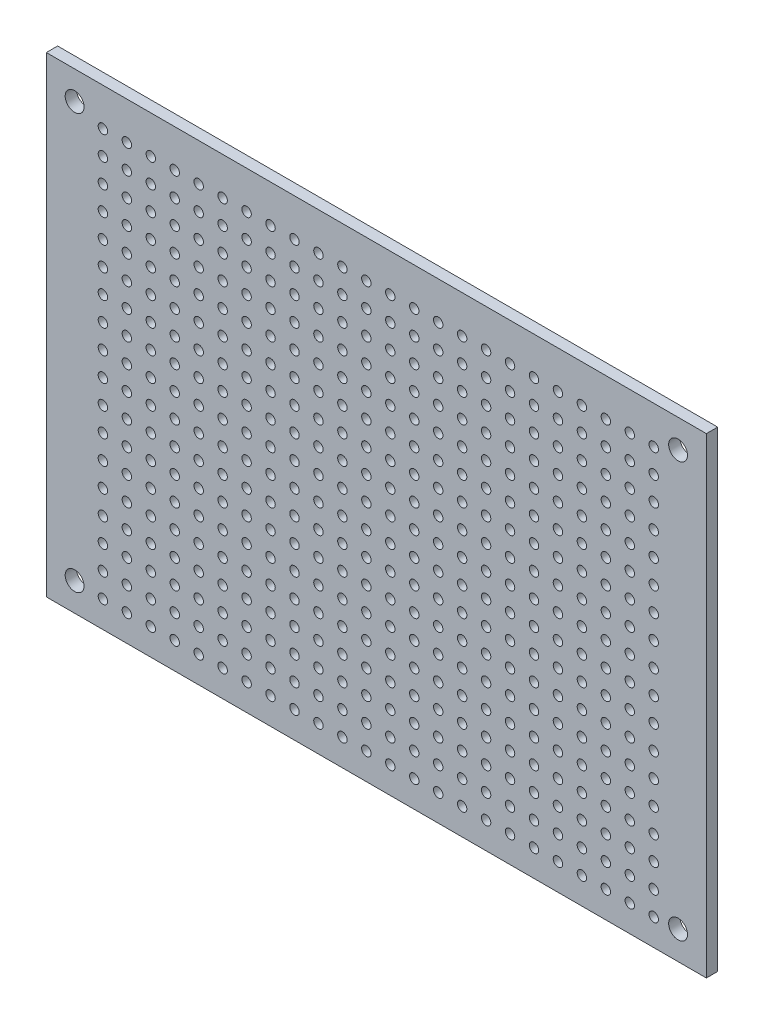
from build123d import *

# Parameters (mm, degrees)
SKETCH_1_W      = 70
SKETCH_1_H      = 50
SKETCH_1_R      = 0.5
SKETCH_1_R_2    = 1
EXTRUDE_1_DEPTH = 1.2


with BuildPart() as part:
    # Эскиз1 → Бобышка-Вытянуть1 (new body)
    with BuildSketch(Plane.XY):
        with Locations((35, 25)):
            Rectangle(SKETCH_1_W, SKETCH_1_H)
        with Locations((6, 46)):
            Circle(SKETCH_1_R, mode=Mode.SUBTRACT)
        with Locations((3, 47)):
            Circle(SKETCH_1_R_2, mode=Mode.SUBTRACT)
        with Locations((67, 47)):
            Circle(SKETCH_1_R_2, mode=Mode.SUBTRACT)
        with Locations((67, 3)):
            Circle(SKETCH_1_R_2, mode=Mode.SUBTRACT)
        with Locations((3, 3)):
            Circle(SKETCH_1_R_2, mode=Mode.SUBTRACT)
        with Locations((8.54, 46)):
            Circle(SKETCH_1_R, mode=Mode.SUBTRACT)
        with Locations((11.08, 46)):
            Circle(SKETCH_1_R, mode=Mode.SUBTRACT)
        with Locations((13.62, 46)):
            Circle(SKETCH_1_R, mode=Mode.SUBTRACT)
        with Locations((16.16, 46)):
            Circle(SKETCH_1_R, mode=Mode.SUBTRACT)
        with Locations((18.7, 46)):
            Circle(SKETCH_1_R, mode=Mode.SUBTRACT)
        with Locations((21.24, 46)):
            Circle(SKETCH_1_R, mode=Mode.SUBTRACT)
        with Locations((23.78, 46)):
            Circle(SKETCH_1_R, mode=Mode.SUBTRACT)
        with Locations((26.32, 46)):
            Circle(SKETCH_1_R, mode=Mode.SUBTRACT)
        with Locations((28.86, 46)):
            Circle(SKETCH_1_R, mode=Mode.SUBTRACT)
        with Locations((31.4, 46)):
            Circle(SKETCH_1_R, mode=Mode.SUBTRACT)
        with Locations((33.94, 46)):
            Circle(SKETCH_1_R, mode=Mode.SUBTRACT)
        with Locations((36.48, 46)):
            Circle(SKETCH_1_R, mode=Mode.SUBTRACT)
        with Locations((39.02, 46)):
            Circle(SKETCH_1_R, mode=Mode.SUBTRACT)
        with Locations((41.56, 46)):
            Circle(SKETCH_1_R, mode=Mode.SUBTRACT)
        with Locations((44.1, 46)):
            Circle(SKETCH_1_R, mode=Mode.SUBTRACT)
        with Locations((46.64, 46)):
            Circle(SKETCH_1_R, mode=Mode.SUBTRACT)
        with Locations((49.18, 46)):
            Circle(SKETCH_1_R, mode=Mode.SUBTRACT)
        with Locations((51.72, 46)):
            Circle(SKETCH_1_R, mode=Mode.SUBTRACT)
        with Locations((54.26, 46)):
            Circle(SKETCH_1_R, mode=Mode.SUBTRACT)
        with Locations((56.8, 46)):
            Circle(SKETCH_1_R, mode=Mode.SUBTRACT)
        with Locations((59.34, 46)):
            Circle(SKETCH_1_R, mode=Mode.SUBTRACT)
        with Locations((61.88, 46)):
            Circle(SKETCH_1_R, mode=Mode.SUBTRACT)
        with Locations((64.42, 46)):
            Circle(SKETCH_1_R, mode=Mode.SUBTRACT)
        with Locations((8.54, 43.46)):
            Circle(SKETCH_1_R, mode=Mode.SUBTRACT)
        with Locations((11.08, 43.46)):
            Circle(SKETCH_1_R, mode=Mode.SUBTRACT)
        with Locations((13.62, 43.46)):
            Circle(SKETCH_1_R, mode=Mode.SUBTRACT)
        with Locations((16.16, 43.46)):
            Circle(SKETCH_1_R, mode=Mode.SUBTRACT)
        with Locations((18.7, 43.46)):
            Circle(SKETCH_1_R, mode=Mode.SUBTRACT)
        with Locations((21.24, 43.46)):
            Circle(SKETCH_1_R, mode=Mode.SUBTRACT)
        with Locations((23.78, 43.46)):
            Circle(SKETCH_1_R, mode=Mode.SUBTRACT)
        with Locations((26.32, 43.46)):
            Circle(SKETCH_1_R, mode=Mode.SUBTRACT)
        with Locations((28.86, 43.46)):
            Circle(SKETCH_1_R, mode=Mode.SUBTRACT)
        with Locations((31.4, 43.46)):
            Circle(SKETCH_1_R, mode=Mode.SUBTRACT)
        with Locations((33.94, 43.46)):
            Circle(SKETCH_1_R, mode=Mode.SUBTRACT)
        with Locations((36.48, 43.46)):
            Circle(SKETCH_1_R, mode=Mode.SUBTRACT)
        with Locations((39.02, 43.46)):
            Circle(SKETCH_1_R, mode=Mode.SUBTRACT)
        with Locations((41.56, 43.46)):
            Circle(SKETCH_1_R, mode=Mode.SUBTRACT)
        with Locations((44.1, 43.46)):
            Circle(SKETCH_1_R, mode=Mode.SUBTRACT)
        with Locations((46.64, 43.46)):
            Circle(SKETCH_1_R, mode=Mode.SUBTRACT)
        with Locations((49.18, 43.46)):
            Circle(SKETCH_1_R, mode=Mode.SUBTRACT)
        with Locations((51.72, 43.46)):
            Circle(SKETCH_1_R, mode=Mode.SUBTRACT)
        with Locations((54.26, 43.46)):
            Circle(SKETCH_1_R, mode=Mode.SUBTRACT)
        with Locations((56.8, 43.46)):
            Circle(SKETCH_1_R, mode=Mode.SUBTRACT)
        with Locations((59.34, 43.46)):
            Circle(SKETCH_1_R, mode=Mode.SUBTRACT)
        with Locations((61.88, 43.46)):
            Circle(SKETCH_1_R, mode=Mode.SUBTRACT)
        with Locations((64.42, 43.46)):
            Circle(SKETCH_1_R, mode=Mode.SUBTRACT)
        with Locations((8.54, 40.92)):
            Circle(SKETCH_1_R, mode=Mode.SUBTRACT)
        with Locations((11.08, 40.92)):
            Circle(SKETCH_1_R, mode=Mode.SUBTRACT)
        with Locations((13.62, 40.92)):
            Circle(SKETCH_1_R, mode=Mode.SUBTRACT)
        with Locations((16.16, 40.92)):
            Circle(SKETCH_1_R, mode=Mode.SUBTRACT)
        with Locations((18.7, 40.92)):
            Circle(SKETCH_1_R, mode=Mode.SUBTRACT)
        with Locations((21.24, 40.92)):
            Circle(SKETCH_1_R, mode=Mode.SUBTRACT)
        with Locations((23.78, 40.92)):
            Circle(SKETCH_1_R, mode=Mode.SUBTRACT)
        with Locations((26.32, 40.92)):
            Circle(SKETCH_1_R, mode=Mode.SUBTRACT)
        with Locations((28.86, 40.92)):
            Circle(SKETCH_1_R, mode=Mode.SUBTRACT)
        with Locations((31.4, 40.92)):
            Circle(SKETCH_1_R, mode=Mode.SUBTRACT)
        with Locations((33.94, 40.92)):
            Circle(SKETCH_1_R, mode=Mode.SUBTRACT)
        with Locations((36.48, 40.92)):
            Circle(SKETCH_1_R, mode=Mode.SUBTRACT)
        with Locations((39.02, 40.92)):
            Circle(SKETCH_1_R, mode=Mode.SUBTRACT)
        with Locations((41.56, 40.92)):
            Circle(SKETCH_1_R, mode=Mode.SUBTRACT)
        with Locations((44.1, 40.92)):
            Circle(SKETCH_1_R, mode=Mode.SUBTRACT)
        with Locations((46.64, 40.92)):
            Circle(SKETCH_1_R, mode=Mode.SUBTRACT)
        with Locations((49.18, 40.92)):
            Circle(SKETCH_1_R, mode=Mode.SUBTRACT)
        with Locations((51.72, 40.92)):
            Circle(SKETCH_1_R, mode=Mode.SUBTRACT)
        with Locations((54.26, 40.92)):
            Circle(SKETCH_1_R, mode=Mode.SUBTRACT)
        with Locations((56.8, 40.92)):
            Circle(SKETCH_1_R, mode=Mode.SUBTRACT)
        with Locations((59.34, 40.92)):
            Circle(SKETCH_1_R, mode=Mode.SUBTRACT)
        with Locations((61.88, 40.92)):
            Circle(SKETCH_1_R, mode=Mode.SUBTRACT)
        with Locations((64.42, 40.92)):
            Circle(SKETCH_1_R, mode=Mode.SUBTRACT)
        with Locations((8.54, 38.38)):
            Circle(SKETCH_1_R, mode=Mode.SUBTRACT)
        with Locations((11.08, 38.38)):
            Circle(SKETCH_1_R, mode=Mode.SUBTRACT)
        with Locations((13.62, 38.38)):
            Circle(SKETCH_1_R, mode=Mode.SUBTRACT)
        with Locations((16.16, 38.38)):
            Circle(SKETCH_1_R, mode=Mode.SUBTRACT)
        with Locations((18.7, 38.38)):
            Circle(SKETCH_1_R, mode=Mode.SUBTRACT)
        with Locations((21.24, 38.38)):
            Circle(SKETCH_1_R, mode=Mode.SUBTRACT)
        with Locations((23.78, 38.38)):
            Circle(SKETCH_1_R, mode=Mode.SUBTRACT)
        with Locations((26.32, 38.38)):
            Circle(SKETCH_1_R, mode=Mode.SUBTRACT)
        with Locations((28.86, 38.38)):
            Circle(SKETCH_1_R, mode=Mode.SUBTRACT)
        with Locations((31.4, 38.38)):
            Circle(SKETCH_1_R, mode=Mode.SUBTRACT)
        with Locations((33.94, 38.38)):
            Circle(SKETCH_1_R, mode=Mode.SUBTRACT)
        with Locations((36.48, 38.38)):
            Circle(SKETCH_1_R, mode=Mode.SUBTRACT)
        with Locations((39.02, 38.38)):
            Circle(SKETCH_1_R, mode=Mode.SUBTRACT)
        with Locations((41.56, 38.38)):
            Circle(SKETCH_1_R, mode=Mode.SUBTRACT)
        with Locations((44.1, 38.38)):
            Circle(SKETCH_1_R, mode=Mode.SUBTRACT)
        with Locations((46.64, 38.38)):
            Circle(SKETCH_1_R, mode=Mode.SUBTRACT)
        with Locations((49.18, 38.38)):
            Circle(SKETCH_1_R, mode=Mode.SUBTRACT)
        with Locations((51.72, 38.38)):
            Circle(SKETCH_1_R, mode=Mode.SUBTRACT)
        with Locations((54.26, 38.38)):
            Circle(SKETCH_1_R, mode=Mode.SUBTRACT)
        with Locations((56.8, 38.38)):
            Circle(SKETCH_1_R, mode=Mode.SUBTRACT)
        with Locations((59.34, 38.38)):
            Circle(SKETCH_1_R, mode=Mode.SUBTRACT)
        with Locations((61.88, 38.38)):
            Circle(SKETCH_1_R, mode=Mode.SUBTRACT)
        with Locations((64.42, 38.38)):
            Circle(SKETCH_1_R, mode=Mode.SUBTRACT)
        with Locations((8.54, 35.84)):
            Circle(SKETCH_1_R, mode=Mode.SUBTRACT)
        with Locations((11.08, 35.84)):
            Circle(SKETCH_1_R, mode=Mode.SUBTRACT)
        with Locations((13.62, 35.84)):
            Circle(SKETCH_1_R, mode=Mode.SUBTRACT)
        with Locations((16.16, 35.84)):
            Circle(SKETCH_1_R, mode=Mode.SUBTRACT)
        with Locations((18.7, 35.84)):
            Circle(SKETCH_1_R, mode=Mode.SUBTRACT)
        with Locations((21.24, 35.84)):
            Circle(SKETCH_1_R, mode=Mode.SUBTRACT)
        with Locations((23.78, 35.84)):
            Circle(SKETCH_1_R, mode=Mode.SUBTRACT)
        with Locations((26.32, 35.84)):
            Circle(SKETCH_1_R, mode=Mode.SUBTRACT)
        with Locations((28.86, 35.84)):
            Circle(SKETCH_1_R, mode=Mode.SUBTRACT)
        with Locations((31.4, 35.84)):
            Circle(SKETCH_1_R, mode=Mode.SUBTRACT)
        with Locations((33.94, 35.84)):
            Circle(SKETCH_1_R, mode=Mode.SUBTRACT)
        with Locations((36.48, 35.84)):
            Circle(SKETCH_1_R, mode=Mode.SUBTRACT)
        with Locations((39.02, 35.84)):
            Circle(SKETCH_1_R, mode=Mode.SUBTRACT)
        with Locations((41.56, 35.84)):
            Circle(SKETCH_1_R, mode=Mode.SUBTRACT)
        with Locations((44.1, 35.84)):
            Circle(SKETCH_1_R, mode=Mode.SUBTRACT)
        with Locations((46.64, 35.84)):
            Circle(SKETCH_1_R, mode=Mode.SUBTRACT)
        with Locations((49.18, 35.84)):
            Circle(SKETCH_1_R, mode=Mode.SUBTRACT)
        with Locations((51.72, 35.84)):
            Circle(SKETCH_1_R, mode=Mode.SUBTRACT)
        with Locations((54.26, 35.84)):
            Circle(SKETCH_1_R, mode=Mode.SUBTRACT)
        with Locations((56.8, 35.84)):
            Circle(SKETCH_1_R, mode=Mode.SUBTRACT)
        with Locations((59.34, 35.84)):
            Circle(SKETCH_1_R, mode=Mode.SUBTRACT)
        with Locations((61.88, 35.84)):
            Circle(SKETCH_1_R, mode=Mode.SUBTRACT)
        with Locations((64.42, 35.84)):
            Circle(SKETCH_1_R, mode=Mode.SUBTRACT)
        with Locations((8.54, 33.3)):
            Circle(SKETCH_1_R, mode=Mode.SUBTRACT)
        with Locations((11.08, 33.3)):
            Circle(SKETCH_1_R, mode=Mode.SUBTRACT)
        with Locations((13.62, 33.3)):
            Circle(SKETCH_1_R, mode=Mode.SUBTRACT)
        with Locations((16.16, 33.3)):
            Circle(SKETCH_1_R, mode=Mode.SUBTRACT)
        with Locations((18.7, 33.3)):
            Circle(SKETCH_1_R, mode=Mode.SUBTRACT)
        with Locations((21.24, 33.3)):
            Circle(SKETCH_1_R, mode=Mode.SUBTRACT)
        with Locations((23.78, 33.3)):
            Circle(SKETCH_1_R, mode=Mode.SUBTRACT)
        with Locations((26.32, 33.3)):
            Circle(SKETCH_1_R, mode=Mode.SUBTRACT)
        with Locations((28.86, 33.3)):
            Circle(SKETCH_1_R, mode=Mode.SUBTRACT)
        with Locations((31.4, 33.3)):
            Circle(SKETCH_1_R, mode=Mode.SUBTRACT)
        with Locations((33.94, 33.3)):
            Circle(SKETCH_1_R, mode=Mode.SUBTRACT)
        with Locations((36.48, 33.3)):
            Circle(SKETCH_1_R, mode=Mode.SUBTRACT)
        with Locations((39.02, 33.3)):
            Circle(SKETCH_1_R, mode=Mode.SUBTRACT)
        with Locations((41.56, 33.3)):
            Circle(SKETCH_1_R, mode=Mode.SUBTRACT)
        with Locations((44.1, 33.3)):
            Circle(SKETCH_1_R, mode=Mode.SUBTRACT)
        with Locations((46.64, 33.3)):
            Circle(SKETCH_1_R, mode=Mode.SUBTRACT)
        with Locations((49.18, 33.3)):
            Circle(SKETCH_1_R, mode=Mode.SUBTRACT)
        with Locations((51.72, 33.3)):
            Circle(SKETCH_1_R, mode=Mode.SUBTRACT)
        with Locations((54.26, 33.3)):
            Circle(SKETCH_1_R, mode=Mode.SUBTRACT)
        with Locations((56.8, 33.3)):
            Circle(SKETCH_1_R, mode=Mode.SUBTRACT)
        with Locations((59.34, 33.3)):
            Circle(SKETCH_1_R, mode=Mode.SUBTRACT)
        with Locations((61.88, 33.3)):
            Circle(SKETCH_1_R, mode=Mode.SUBTRACT)
        with Locations((64.42, 33.3)):
            Circle(SKETCH_1_R, mode=Mode.SUBTRACT)
        with Locations((8.54, 30.76)):
            Circle(SKETCH_1_R, mode=Mode.SUBTRACT)
        with Locations((11.08, 30.76)):
            Circle(SKETCH_1_R, mode=Mode.SUBTRACT)
        with Locations((13.62, 30.76)):
            Circle(SKETCH_1_R, mode=Mode.SUBTRACT)
        with Locations((16.16, 30.76)):
            Circle(SKETCH_1_R, mode=Mode.SUBTRACT)
        with Locations((18.7, 30.76)):
            Circle(SKETCH_1_R, mode=Mode.SUBTRACT)
        with Locations((21.24, 30.76)):
            Circle(SKETCH_1_R, mode=Mode.SUBTRACT)
        with Locations((23.78, 30.76)):
            Circle(SKETCH_1_R, mode=Mode.SUBTRACT)
        with Locations((26.32, 30.76)):
            Circle(SKETCH_1_R, mode=Mode.SUBTRACT)
        with Locations((28.86, 30.76)):
            Circle(SKETCH_1_R, mode=Mode.SUBTRACT)
        with Locations((31.4, 30.76)):
            Circle(SKETCH_1_R, mode=Mode.SUBTRACT)
        with Locations((33.94, 30.76)):
            Circle(SKETCH_1_R, mode=Mode.SUBTRACT)
        with Locations((36.48, 30.76)):
            Circle(SKETCH_1_R, mode=Mode.SUBTRACT)
        with Locations((39.02, 30.76)):
            Circle(SKETCH_1_R, mode=Mode.SUBTRACT)
        with Locations((41.56, 30.76)):
            Circle(SKETCH_1_R, mode=Mode.SUBTRACT)
        with Locations((44.1, 30.76)):
            Circle(SKETCH_1_R, mode=Mode.SUBTRACT)
        with Locations((46.64, 30.76)):
            Circle(SKETCH_1_R, mode=Mode.SUBTRACT)
        with Locations((49.18, 30.76)):
            Circle(SKETCH_1_R, mode=Mode.SUBTRACT)
        with Locations((51.72, 30.76)):
            Circle(SKETCH_1_R, mode=Mode.SUBTRACT)
        with Locations((54.26, 30.76)):
            Circle(SKETCH_1_R, mode=Mode.SUBTRACT)
        with Locations((56.8, 30.76)):
            Circle(SKETCH_1_R, mode=Mode.SUBTRACT)
        with Locations((59.34, 30.76)):
            Circle(SKETCH_1_R, mode=Mode.SUBTRACT)
        with Locations((61.88, 30.76)):
            Circle(SKETCH_1_R, mode=Mode.SUBTRACT)
        with Locations((64.42, 30.76)):
            Circle(SKETCH_1_R, mode=Mode.SUBTRACT)
        with Locations((8.54, 28.22)):
            Circle(SKETCH_1_R, mode=Mode.SUBTRACT)
        with Locations((11.08, 28.22)):
            Circle(SKETCH_1_R, mode=Mode.SUBTRACT)
        with Locations((13.62, 28.22)):
            Circle(SKETCH_1_R, mode=Mode.SUBTRACT)
        with Locations((16.16, 28.22)):
            Circle(SKETCH_1_R, mode=Mode.SUBTRACT)
        with Locations((18.7, 28.22)):
            Circle(SKETCH_1_R, mode=Mode.SUBTRACT)
        with Locations((21.24, 28.22)):
            Circle(SKETCH_1_R, mode=Mode.SUBTRACT)
        with Locations((23.78, 28.22)):
            Circle(SKETCH_1_R, mode=Mode.SUBTRACT)
        with Locations((26.32, 28.22)):
            Circle(SKETCH_1_R, mode=Mode.SUBTRACT)
        with Locations((28.86, 28.22)):
            Circle(SKETCH_1_R, mode=Mode.SUBTRACT)
        with Locations((31.4, 28.22)):
            Circle(SKETCH_1_R, mode=Mode.SUBTRACT)
        with Locations((33.94, 28.22)):
            Circle(SKETCH_1_R, mode=Mode.SUBTRACT)
        with Locations((36.48, 28.22)):
            Circle(SKETCH_1_R, mode=Mode.SUBTRACT)
        with Locations((39.02, 28.22)):
            Circle(SKETCH_1_R, mode=Mode.SUBTRACT)
        with Locations((41.56, 28.22)):
            Circle(SKETCH_1_R, mode=Mode.SUBTRACT)
        with Locations((44.1, 28.22)):
            Circle(SKETCH_1_R, mode=Mode.SUBTRACT)
        with Locations((46.64, 28.22)):
            Circle(SKETCH_1_R, mode=Mode.SUBTRACT)
        with Locations((49.18, 28.22)):
            Circle(SKETCH_1_R, mode=Mode.SUBTRACT)
        with Locations((51.72, 28.22)):
            Circle(SKETCH_1_R, mode=Mode.SUBTRACT)
        with Locations((54.26, 28.22)):
            Circle(SKETCH_1_R, mode=Mode.SUBTRACT)
        with Locations((56.8, 28.22)):
            Circle(SKETCH_1_R, mode=Mode.SUBTRACT)
        with Locations((59.34, 28.22)):
            Circle(SKETCH_1_R, mode=Mode.SUBTRACT)
        with Locations((61.88, 28.22)):
            Circle(SKETCH_1_R, mode=Mode.SUBTRACT)
        with Locations((64.42, 28.22)):
            Circle(SKETCH_1_R, mode=Mode.SUBTRACT)
        with Locations((8.54, 25.68)):
            Circle(SKETCH_1_R, mode=Mode.SUBTRACT)
        with Locations((11.08, 25.68)):
            Circle(SKETCH_1_R, mode=Mode.SUBTRACT)
        with Locations((13.62, 25.68)):
            Circle(SKETCH_1_R, mode=Mode.SUBTRACT)
        with Locations((16.16, 25.68)):
            Circle(SKETCH_1_R, mode=Mode.SUBTRACT)
        with Locations((18.7, 25.68)):
            Circle(SKETCH_1_R, mode=Mode.SUBTRACT)
        with Locations((21.24, 25.68)):
            Circle(SKETCH_1_R, mode=Mode.SUBTRACT)
        with Locations((23.78, 25.68)):
            Circle(SKETCH_1_R, mode=Mode.SUBTRACT)
        with Locations((26.32, 25.68)):
            Circle(SKETCH_1_R, mode=Mode.SUBTRACT)
        with Locations((28.86, 25.68)):
            Circle(SKETCH_1_R, mode=Mode.SUBTRACT)
        with Locations((31.4, 25.68)):
            Circle(SKETCH_1_R, mode=Mode.SUBTRACT)
        with Locations((33.94, 25.68)):
            Circle(SKETCH_1_R, mode=Mode.SUBTRACT)
        with Locations((36.48, 25.68)):
            Circle(SKETCH_1_R, mode=Mode.SUBTRACT)
        with Locations((39.02, 25.68)):
            Circle(SKETCH_1_R, mode=Mode.SUBTRACT)
        with Locations((41.56, 25.68)):
            Circle(SKETCH_1_R, mode=Mode.SUBTRACT)
        with Locations((44.1, 25.68)):
            Circle(SKETCH_1_R, mode=Mode.SUBTRACT)
        with Locations((46.64, 25.68)):
            Circle(SKETCH_1_R, mode=Mode.SUBTRACT)
        with Locations((49.18, 25.68)):
            Circle(SKETCH_1_R, mode=Mode.SUBTRACT)
        with Locations((51.72, 25.68)):
            Circle(SKETCH_1_R, mode=Mode.SUBTRACT)
        with Locations((54.26, 25.68)):
            Circle(SKETCH_1_R, mode=Mode.SUBTRACT)
        with Locations((56.8, 25.68)):
            Circle(SKETCH_1_R, mode=Mode.SUBTRACT)
        with Locations((59.34, 25.68)):
            Circle(SKETCH_1_R, mode=Mode.SUBTRACT)
        with Locations((61.88, 25.68)):
            Circle(SKETCH_1_R, mode=Mode.SUBTRACT)
        with Locations((64.42, 25.68)):
            Circle(SKETCH_1_R, mode=Mode.SUBTRACT)
        with Locations((8.54, 23.14)):
            Circle(SKETCH_1_R, mode=Mode.SUBTRACT)
        with Locations((11.08, 23.14)):
            Circle(SKETCH_1_R, mode=Mode.SUBTRACT)
        with Locations((13.62, 23.14)):
            Circle(SKETCH_1_R, mode=Mode.SUBTRACT)
        with Locations((16.16, 23.14)):
            Circle(SKETCH_1_R, mode=Mode.SUBTRACT)
        with Locations((18.7, 23.14)):
            Circle(SKETCH_1_R, mode=Mode.SUBTRACT)
        with Locations((21.24, 23.14)):
            Circle(SKETCH_1_R, mode=Mode.SUBTRACT)
        with Locations((23.78, 23.14)):
            Circle(SKETCH_1_R, mode=Mode.SUBTRACT)
        with Locations((26.32, 23.14)):
            Circle(SKETCH_1_R, mode=Mode.SUBTRACT)
        with Locations((28.86, 23.14)):
            Circle(SKETCH_1_R, mode=Mode.SUBTRACT)
        with Locations((31.4, 23.14)):
            Circle(SKETCH_1_R, mode=Mode.SUBTRACT)
        with Locations((33.94, 23.14)):
            Circle(SKETCH_1_R, mode=Mode.SUBTRACT)
        with Locations((36.48, 23.14)):
            Circle(SKETCH_1_R, mode=Mode.SUBTRACT)
        with Locations((39.02, 23.14)):
            Circle(SKETCH_1_R, mode=Mode.SUBTRACT)
        with Locations((41.56, 23.14)):
            Circle(SKETCH_1_R, mode=Mode.SUBTRACT)
        with Locations((44.1, 23.14)):
            Circle(SKETCH_1_R, mode=Mode.SUBTRACT)
        with Locations((46.64, 23.14)):
            Circle(SKETCH_1_R, mode=Mode.SUBTRACT)
        with Locations((49.18, 23.14)):
            Circle(SKETCH_1_R, mode=Mode.SUBTRACT)
        with Locations((51.72, 23.14)):
            Circle(SKETCH_1_R, mode=Mode.SUBTRACT)
        with Locations((54.26, 23.14)):
            Circle(SKETCH_1_R, mode=Mode.SUBTRACT)
        with Locations((56.8, 23.14)):
            Circle(SKETCH_1_R, mode=Mode.SUBTRACT)
        with Locations((59.34, 23.14)):
            Circle(SKETCH_1_R, mode=Mode.SUBTRACT)
        with Locations((61.88, 23.14)):
            Circle(SKETCH_1_R, mode=Mode.SUBTRACT)
        with Locations((64.42, 23.14)):
            Circle(SKETCH_1_R, mode=Mode.SUBTRACT)
        with Locations((8.54, 20.6)):
            Circle(SKETCH_1_R, mode=Mode.SUBTRACT)
        with Locations((11.08, 20.6)):
            Circle(SKETCH_1_R, mode=Mode.SUBTRACT)
        with Locations((13.62, 20.6)):
            Circle(SKETCH_1_R, mode=Mode.SUBTRACT)
        with Locations((16.16, 20.6)):
            Circle(SKETCH_1_R, mode=Mode.SUBTRACT)
        with Locations((18.7, 20.6)):
            Circle(SKETCH_1_R, mode=Mode.SUBTRACT)
        with Locations((21.24, 20.6)):
            Circle(SKETCH_1_R, mode=Mode.SUBTRACT)
        with Locations((23.78, 20.6)):
            Circle(SKETCH_1_R, mode=Mode.SUBTRACT)
        with Locations((26.32, 20.6)):
            Circle(SKETCH_1_R, mode=Mode.SUBTRACT)
        with Locations((28.86, 20.6)):
            Circle(SKETCH_1_R, mode=Mode.SUBTRACT)
        with Locations((31.4, 20.6)):
            Circle(SKETCH_1_R, mode=Mode.SUBTRACT)
        with Locations((33.94, 20.6)):
            Circle(SKETCH_1_R, mode=Mode.SUBTRACT)
        with Locations((36.48, 20.6)):
            Circle(SKETCH_1_R, mode=Mode.SUBTRACT)
        with Locations((39.02, 20.6)):
            Circle(SKETCH_1_R, mode=Mode.SUBTRACT)
        with Locations((41.56, 20.6)):
            Circle(SKETCH_1_R, mode=Mode.SUBTRACT)
        with Locations((44.1, 20.6)):
            Circle(SKETCH_1_R, mode=Mode.SUBTRACT)
        with Locations((46.64, 20.6)):
            Circle(SKETCH_1_R, mode=Mode.SUBTRACT)
        with Locations((49.18, 20.6)):
            Circle(SKETCH_1_R, mode=Mode.SUBTRACT)
        with Locations((51.72, 20.6)):
            Circle(SKETCH_1_R, mode=Mode.SUBTRACT)
        with Locations((54.26, 20.6)):
            Circle(SKETCH_1_R, mode=Mode.SUBTRACT)
        with Locations((56.8, 20.6)):
            Circle(SKETCH_1_R, mode=Mode.SUBTRACT)
        with Locations((59.34, 20.6)):
            Circle(SKETCH_1_R, mode=Mode.SUBTRACT)
        with Locations((61.88, 20.6)):
            Circle(SKETCH_1_R, mode=Mode.SUBTRACT)
        with Locations((64.42, 20.6)):
            Circle(SKETCH_1_R, mode=Mode.SUBTRACT)
        with Locations((8.54, 18.06)):
            Circle(SKETCH_1_R, mode=Mode.SUBTRACT)
        with Locations((11.08, 18.06)):
            Circle(SKETCH_1_R, mode=Mode.SUBTRACT)
        with Locations((13.62, 18.06)):
            Circle(SKETCH_1_R, mode=Mode.SUBTRACT)
        with Locations((16.16, 18.06)):
            Circle(SKETCH_1_R, mode=Mode.SUBTRACT)
        with Locations((18.7, 18.06)):
            Circle(SKETCH_1_R, mode=Mode.SUBTRACT)
        with Locations((21.24, 18.06)):
            Circle(SKETCH_1_R, mode=Mode.SUBTRACT)
        with Locations((23.78, 18.06)):
            Circle(SKETCH_1_R, mode=Mode.SUBTRACT)
        with Locations((26.32, 18.06)):
            Circle(SKETCH_1_R, mode=Mode.SUBTRACT)
        with Locations((28.86, 18.06)):
            Circle(SKETCH_1_R, mode=Mode.SUBTRACT)
        with Locations((31.4, 18.06)):
            Circle(SKETCH_1_R, mode=Mode.SUBTRACT)
        with Locations((33.94, 18.06)):
            Circle(SKETCH_1_R, mode=Mode.SUBTRACT)
        with Locations((36.48, 18.06)):
            Circle(SKETCH_1_R, mode=Mode.SUBTRACT)
        with Locations((39.02, 18.06)):
            Circle(SKETCH_1_R, mode=Mode.SUBTRACT)
        with Locations((41.56, 18.06)):
            Circle(SKETCH_1_R, mode=Mode.SUBTRACT)
        with Locations((44.1, 18.06)):
            Circle(SKETCH_1_R, mode=Mode.SUBTRACT)
        with Locations((46.64, 18.06)):
            Circle(SKETCH_1_R, mode=Mode.SUBTRACT)
        with Locations((49.18, 18.06)):
            Circle(SKETCH_1_R, mode=Mode.SUBTRACT)
        with Locations((51.72, 18.06)):
            Circle(SKETCH_1_R, mode=Mode.SUBTRACT)
        with Locations((54.26, 18.06)):
            Circle(SKETCH_1_R, mode=Mode.SUBTRACT)
        with Locations((56.8, 18.06)):
            Circle(SKETCH_1_R, mode=Mode.SUBTRACT)
        with Locations((59.34, 18.06)):
            Circle(SKETCH_1_R, mode=Mode.SUBTRACT)
        with Locations((61.88, 18.06)):
            Circle(SKETCH_1_R, mode=Mode.SUBTRACT)
        with Locations((64.42, 18.06)):
            Circle(SKETCH_1_R, mode=Mode.SUBTRACT)
        with Locations((8.54, 15.52)):
            Circle(SKETCH_1_R, mode=Mode.SUBTRACT)
        with Locations((11.08, 15.52)):
            Circle(SKETCH_1_R, mode=Mode.SUBTRACT)
        with Locations((13.62, 15.52)):
            Circle(SKETCH_1_R, mode=Mode.SUBTRACT)
        with Locations((16.16, 15.52)):
            Circle(SKETCH_1_R, mode=Mode.SUBTRACT)
        with Locations((18.7, 15.52)):
            Circle(SKETCH_1_R, mode=Mode.SUBTRACT)
        with Locations((21.24, 15.52)):
            Circle(SKETCH_1_R, mode=Mode.SUBTRACT)
        with Locations((23.78, 15.52)):
            Circle(SKETCH_1_R, mode=Mode.SUBTRACT)
        with Locations((26.32, 15.52)):
            Circle(SKETCH_1_R, mode=Mode.SUBTRACT)
        with Locations((28.86, 15.52)):
            Circle(SKETCH_1_R, mode=Mode.SUBTRACT)
        with Locations((31.4, 15.52)):
            Circle(SKETCH_1_R, mode=Mode.SUBTRACT)
        with Locations((33.94, 15.52)):
            Circle(SKETCH_1_R, mode=Mode.SUBTRACT)
        with Locations((36.48, 15.52)):
            Circle(SKETCH_1_R, mode=Mode.SUBTRACT)
        with Locations((39.02, 15.52)):
            Circle(SKETCH_1_R, mode=Mode.SUBTRACT)
        with Locations((41.56, 15.52)):
            Circle(SKETCH_1_R, mode=Mode.SUBTRACT)
        with Locations((44.1, 15.52)):
            Circle(SKETCH_1_R, mode=Mode.SUBTRACT)
        with Locations((46.64, 15.52)):
            Circle(SKETCH_1_R, mode=Mode.SUBTRACT)
        with Locations((49.18, 15.52)):
            Circle(SKETCH_1_R, mode=Mode.SUBTRACT)
        with Locations((51.72, 15.52)):
            Circle(SKETCH_1_R, mode=Mode.SUBTRACT)
        with Locations((54.26, 15.52)):
            Circle(SKETCH_1_R, mode=Mode.SUBTRACT)
        with Locations((56.8, 15.52)):
            Circle(SKETCH_1_R, mode=Mode.SUBTRACT)
        with Locations((59.34, 15.52)):
            Circle(SKETCH_1_R, mode=Mode.SUBTRACT)
        with Locations((61.88, 15.52)):
            Circle(SKETCH_1_R, mode=Mode.SUBTRACT)
        with Locations((64.42, 15.52)):
            Circle(SKETCH_1_R, mode=Mode.SUBTRACT)
        with Locations((8.54, 12.98)):
            Circle(SKETCH_1_R, mode=Mode.SUBTRACT)
        with Locations((11.08, 12.98)):
            Circle(SKETCH_1_R, mode=Mode.SUBTRACT)
        with Locations((13.62, 12.98)):
            Circle(SKETCH_1_R, mode=Mode.SUBTRACT)
        with Locations((16.16, 12.98)):
            Circle(SKETCH_1_R, mode=Mode.SUBTRACT)
        with Locations((18.7, 12.98)):
            Circle(SKETCH_1_R, mode=Mode.SUBTRACT)
        with Locations((21.24, 12.98)):
            Circle(SKETCH_1_R, mode=Mode.SUBTRACT)
        with Locations((23.78, 12.98)):
            Circle(SKETCH_1_R, mode=Mode.SUBTRACT)
        with Locations((26.32, 12.98)):
            Circle(SKETCH_1_R, mode=Mode.SUBTRACT)
        with Locations((28.86, 12.98)):
            Circle(SKETCH_1_R, mode=Mode.SUBTRACT)
        with Locations((31.4, 12.98)):
            Circle(SKETCH_1_R, mode=Mode.SUBTRACT)
        with Locations((33.94, 12.98)):
            Circle(SKETCH_1_R, mode=Mode.SUBTRACT)
        with Locations((36.48, 12.98)):
            Circle(SKETCH_1_R, mode=Mode.SUBTRACT)
        with Locations((39.02, 12.98)):
            Circle(SKETCH_1_R, mode=Mode.SUBTRACT)
        with Locations((41.56, 12.98)):
            Circle(SKETCH_1_R, mode=Mode.SUBTRACT)
        with Locations((44.1, 12.98)):
            Circle(SKETCH_1_R, mode=Mode.SUBTRACT)
        with Locations((46.64, 12.98)):
            Circle(SKETCH_1_R, mode=Mode.SUBTRACT)
        with Locations((49.18, 12.98)):
            Circle(SKETCH_1_R, mode=Mode.SUBTRACT)
        with Locations((51.72, 12.98)):
            Circle(SKETCH_1_R, mode=Mode.SUBTRACT)
        with Locations((54.26, 12.98)):
            Circle(SKETCH_1_R, mode=Mode.SUBTRACT)
        with Locations((56.8, 12.98)):
            Circle(SKETCH_1_R, mode=Mode.SUBTRACT)
        with Locations((59.34, 12.98)):
            Circle(SKETCH_1_R, mode=Mode.SUBTRACT)
        with Locations((61.88, 12.98)):
            Circle(SKETCH_1_R, mode=Mode.SUBTRACT)
        with Locations((64.42, 12.98)):
            Circle(SKETCH_1_R, mode=Mode.SUBTRACT)
        with Locations((8.54, 10.44)):
            Circle(SKETCH_1_R, mode=Mode.SUBTRACT)
        with Locations((11.08, 10.44)):
            Circle(SKETCH_1_R, mode=Mode.SUBTRACT)
        with Locations((13.62, 10.44)):
            Circle(SKETCH_1_R, mode=Mode.SUBTRACT)
        with Locations((16.16, 10.44)):
            Circle(SKETCH_1_R, mode=Mode.SUBTRACT)
        with Locations((18.7, 10.44)):
            Circle(SKETCH_1_R, mode=Mode.SUBTRACT)
        with Locations((21.24, 10.44)):
            Circle(SKETCH_1_R, mode=Mode.SUBTRACT)
        with Locations((23.78, 10.44)):
            Circle(SKETCH_1_R, mode=Mode.SUBTRACT)
        with Locations((26.32, 10.44)):
            Circle(SKETCH_1_R, mode=Mode.SUBTRACT)
        with Locations((28.86, 10.44)):
            Circle(SKETCH_1_R, mode=Mode.SUBTRACT)
        with Locations((31.4, 10.44)):
            Circle(SKETCH_1_R, mode=Mode.SUBTRACT)
        with Locations((33.94, 10.44)):
            Circle(SKETCH_1_R, mode=Mode.SUBTRACT)
        with Locations((36.48, 10.44)):
            Circle(SKETCH_1_R, mode=Mode.SUBTRACT)
        with Locations((39.02, 10.44)):
            Circle(SKETCH_1_R, mode=Mode.SUBTRACT)
        with Locations((41.56, 10.44)):
            Circle(SKETCH_1_R, mode=Mode.SUBTRACT)
        with Locations((44.1, 10.44)):
            Circle(SKETCH_1_R, mode=Mode.SUBTRACT)
        with Locations((46.64, 10.44)):
            Circle(SKETCH_1_R, mode=Mode.SUBTRACT)
        with Locations((49.18, 10.44)):
            Circle(SKETCH_1_R, mode=Mode.SUBTRACT)
        with Locations((51.72, 10.44)):
            Circle(SKETCH_1_R, mode=Mode.SUBTRACT)
        with Locations((54.26, 10.44)):
            Circle(SKETCH_1_R, mode=Mode.SUBTRACT)
        with Locations((56.8, 10.44)):
            Circle(SKETCH_1_R, mode=Mode.SUBTRACT)
        with Locations((59.34, 10.44)):
            Circle(SKETCH_1_R, mode=Mode.SUBTRACT)
        with Locations((61.88, 10.44)):
            Circle(SKETCH_1_R, mode=Mode.SUBTRACT)
        with Locations((64.42, 10.44)):
            Circle(SKETCH_1_R, mode=Mode.SUBTRACT)
        with Locations((8.54, 7.9)):
            Circle(SKETCH_1_R, mode=Mode.SUBTRACT)
        with Locations((11.08, 7.9)):
            Circle(SKETCH_1_R, mode=Mode.SUBTRACT)
        with Locations((13.62, 7.9)):
            Circle(SKETCH_1_R, mode=Mode.SUBTRACT)
        with Locations((16.16, 7.9)):
            Circle(SKETCH_1_R, mode=Mode.SUBTRACT)
        with Locations((18.7, 7.9)):
            Circle(SKETCH_1_R, mode=Mode.SUBTRACT)
        with Locations((21.24, 7.9)):
            Circle(SKETCH_1_R, mode=Mode.SUBTRACT)
        with Locations((23.78, 7.9)):
            Circle(SKETCH_1_R, mode=Mode.SUBTRACT)
        with Locations((26.32, 7.9)):
            Circle(SKETCH_1_R, mode=Mode.SUBTRACT)
        with Locations((28.86, 7.9)):
            Circle(SKETCH_1_R, mode=Mode.SUBTRACT)
        with Locations((31.4, 7.9)):
            Circle(SKETCH_1_R, mode=Mode.SUBTRACT)
        with Locations((33.94, 7.9)):
            Circle(SKETCH_1_R, mode=Mode.SUBTRACT)
        with Locations((36.48, 7.9)):
            Circle(SKETCH_1_R, mode=Mode.SUBTRACT)
        with Locations((39.02, 7.9)):
            Circle(SKETCH_1_R, mode=Mode.SUBTRACT)
        with Locations((41.56, 7.9)):
            Circle(SKETCH_1_R, mode=Mode.SUBTRACT)
        with Locations((44.1, 7.9)):
            Circle(SKETCH_1_R, mode=Mode.SUBTRACT)
        with Locations((46.64, 7.9)):
            Circle(SKETCH_1_R, mode=Mode.SUBTRACT)
        with Locations((49.18, 7.9)):
            Circle(SKETCH_1_R, mode=Mode.SUBTRACT)
        with Locations((51.72, 7.9)):
            Circle(SKETCH_1_R, mode=Mode.SUBTRACT)
        with Locations((54.26, 7.9)):
            Circle(SKETCH_1_R, mode=Mode.SUBTRACT)
        with Locations((56.8, 7.9)):
            Circle(SKETCH_1_R, mode=Mode.SUBTRACT)
        with Locations((59.34, 7.9)):
            Circle(SKETCH_1_R, mode=Mode.SUBTRACT)
        with Locations((61.88, 7.9)):
            Circle(SKETCH_1_R, mode=Mode.SUBTRACT)
        with Locations((64.42, 7.9)):
            Circle(SKETCH_1_R, mode=Mode.SUBTRACT)
        with Locations((8.54, 5.36)):
            Circle(SKETCH_1_R, mode=Mode.SUBTRACT)
        with Locations((11.08, 5.36)):
            Circle(SKETCH_1_R, mode=Mode.SUBTRACT)
        with Locations((13.62, 5.36)):
            Circle(SKETCH_1_R, mode=Mode.SUBTRACT)
        with Locations((16.16, 5.36)):
            Circle(SKETCH_1_R, mode=Mode.SUBTRACT)
        with Locations((18.7, 5.36)):
            Circle(SKETCH_1_R, mode=Mode.SUBTRACT)
        with Locations((21.24, 5.36)):
            Circle(SKETCH_1_R, mode=Mode.SUBTRACT)
        with Locations((23.78, 5.36)):
            Circle(SKETCH_1_R, mode=Mode.SUBTRACT)
        with Locations((26.32, 5.36)):
            Circle(SKETCH_1_R, mode=Mode.SUBTRACT)
        with Locations((28.86, 5.36)):
            Circle(SKETCH_1_R, mode=Mode.SUBTRACT)
        with Locations((31.4, 5.36)):
            Circle(SKETCH_1_R, mode=Mode.SUBTRACT)
        with Locations((33.94, 5.36)):
            Circle(SKETCH_1_R, mode=Mode.SUBTRACT)
        with Locations((36.48, 5.36)):
            Circle(SKETCH_1_R, mode=Mode.SUBTRACT)
        with Locations((39.02, 5.36)):
            Circle(SKETCH_1_R, mode=Mode.SUBTRACT)
        with Locations((41.56, 5.36)):
            Circle(SKETCH_1_R, mode=Mode.SUBTRACT)
        with Locations((44.1, 5.36)):
            Circle(SKETCH_1_R, mode=Mode.SUBTRACT)
        with Locations((46.64, 5.36)):
            Circle(SKETCH_1_R, mode=Mode.SUBTRACT)
        with Locations((49.18, 5.36)):
            Circle(SKETCH_1_R, mode=Mode.SUBTRACT)
        with Locations((51.72, 5.36)):
            Circle(SKETCH_1_R, mode=Mode.SUBTRACT)
        with Locations((54.26, 5.36)):
            Circle(SKETCH_1_R, mode=Mode.SUBTRACT)
        with Locations((56.8, 5.36)):
            Circle(SKETCH_1_R, mode=Mode.SUBTRACT)
        with Locations((59.34, 5.36)):
            Circle(SKETCH_1_R, mode=Mode.SUBTRACT)
        with Locations((61.88, 5.36)):
            Circle(SKETCH_1_R, mode=Mode.SUBTRACT)
        with Locations((64.42, 5.36)):
            Circle(SKETCH_1_R, mode=Mode.SUBTRACT)
        with Locations((8.54, 2.82)):
            Circle(SKETCH_1_R, mode=Mode.SUBTRACT)
        with Locations((11.08, 2.82)):
            Circle(SKETCH_1_R, mode=Mode.SUBTRACT)
        with Locations((13.62, 2.82)):
            Circle(SKETCH_1_R, mode=Mode.SUBTRACT)
        with Locations((16.16, 2.82)):
            Circle(SKETCH_1_R, mode=Mode.SUBTRACT)
        with Locations((18.7, 2.82)):
            Circle(SKETCH_1_R, mode=Mode.SUBTRACT)
        with Locations((21.24, 2.82)):
            Circle(SKETCH_1_R, mode=Mode.SUBTRACT)
        with Locations((23.78, 2.82)):
            Circle(SKETCH_1_R, mode=Mode.SUBTRACT)
        with Locations((26.32, 2.82)):
            Circle(SKETCH_1_R, mode=Mode.SUBTRACT)
        with Locations((28.86, 2.82)):
            Circle(SKETCH_1_R, mode=Mode.SUBTRACT)
        with Locations((31.4, 2.82)):
            Circle(SKETCH_1_R, mode=Mode.SUBTRACT)
        with Locations((33.94, 2.82)):
            Circle(SKETCH_1_R, mode=Mode.SUBTRACT)
        with Locations((36.48, 2.82)):
            Circle(SKETCH_1_R, mode=Mode.SUBTRACT)
        with Locations((39.02, 2.82)):
            Circle(SKETCH_1_R, mode=Mode.SUBTRACT)
        with Locations((41.56, 2.82)):
            Circle(SKETCH_1_R, mode=Mode.SUBTRACT)
        with Locations((44.1, 2.82)):
            Circle(SKETCH_1_R, mode=Mode.SUBTRACT)
        with Locations((46.64, 2.82)):
            Circle(SKETCH_1_R, mode=Mode.SUBTRACT)
        with Locations((49.18, 2.82)):
            Circle(SKETCH_1_R, mode=Mode.SUBTRACT)
        with Locations((51.72, 2.82)):
            Circle(SKETCH_1_R, mode=Mode.SUBTRACT)
        with Locations((54.26, 2.82)):
            Circle(SKETCH_1_R, mode=Mode.SUBTRACT)
        with Locations((56.8, 2.82)):
            Circle(SKETCH_1_R, mode=Mode.SUBTRACT)
        with Locations((59.34, 2.82)):
            Circle(SKETCH_1_R, mode=Mode.SUBTRACT)
        with Locations((61.88, 2.82)):
            Circle(SKETCH_1_R, mode=Mode.SUBTRACT)
        with Locations((64.42, 2.82)):
            Circle(SKETCH_1_R, mode=Mode.SUBTRACT)
        with Locations((6, 43.46)):
            Circle(SKETCH_1_R, mode=Mode.SUBTRACT)
        with Locations((6, 40.92)):
            Circle(SKETCH_1_R, mode=Mode.SUBTRACT)
        with Locations((6, 38.38)):
            Circle(SKETCH_1_R, mode=Mode.SUBTRACT)
        with Locations((6, 35.84)):
            Circle(SKETCH_1_R, mode=Mode.SUBTRACT)
        with Locations((6, 33.3)):
            Circle(SKETCH_1_R, mode=Mode.SUBTRACT)
        with Locations((6, 30.76)):
            Circle(SKETCH_1_R, mode=Mode.SUBTRACT)
        with Locations((6, 28.22)):
            Circle(SKETCH_1_R, mode=Mode.SUBTRACT)
        with Locations((6, 25.68)):
            Circle(SKETCH_1_R, mode=Mode.SUBTRACT)
        with Locations((6, 23.14)):
            Circle(SKETCH_1_R, mode=Mode.SUBTRACT)
        with Locations((6, 20.6)):
            Circle(SKETCH_1_R, mode=Mode.SUBTRACT)
        with Locations((6, 18.06)):
            Circle(SKETCH_1_R, mode=Mode.SUBTRACT)
        with Locations((6, 15.52)):
            Circle(SKETCH_1_R, mode=Mode.SUBTRACT)
        with Locations((6, 12.98)):
            Circle(SKETCH_1_R, mode=Mode.SUBTRACT)
        with Locations((6, 10.44)):
            Circle(SKETCH_1_R, mode=Mode.SUBTRACT)
        with Locations((6, 7.9)):
            Circle(SKETCH_1_R, mode=Mode.SUBTRACT)
        with Locations((6, 5.36)):
            Circle(SKETCH_1_R, mode=Mode.SUBTRACT)
        with Locations((6, 2.82)):
            Circle(SKETCH_1_R, mode=Mode.SUBTRACT)
    extrude(amount=EXTRUDE_1_DEPTH)


solid = part.part
